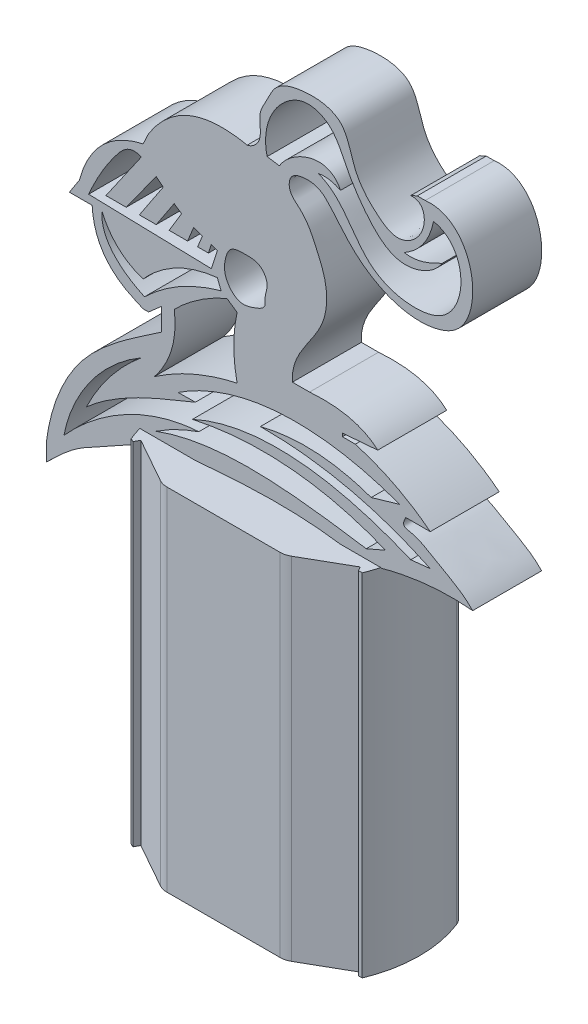
from build123d import *

# Parameters (mm, degrees)
BOSS_EXTRUDE3_DEPTH     = 19.558
SKETCH3_R               = 35.486653225
BOSS_EXTRUDE4_DEPTH     = 99.480957
CUT_EXTRUDE_THIN2_DEPTH = 99.480957295
CUT_EXTRUDE1_DEPTH      = 300.228
FILLET4_R               = 5.08
FILLET5_R               = 5.08


# Read off the part's stored shape, not the designer's step: Cut-Extrude-Thin2
with BuildPart() as part:
    # Sketch1 → Boss-Extrude3 (new body)
    with BuildSketch(Plane.XY):
        with BuildLine():
            Line((-60.677152208, 82.715970074), (-60.677152208, 77.913415786))
            add(Edge.make_bspline(
                [(30.016770012, 98.07305176), (20.185298771, 100.36910014), (4.789458608, 101.194375677), (-14.213048057, 99.85670085), (-30.375831286, 98.43035412), (-41.551512661, 91.295063212), (-53.246281565, 85.238550148), (-57.793663734, 80.827018036), (-60.677152208, 77.913415786)],
                knots=[0, 0, 0, 0, 0.31158423, 0.47315705, 0.592132294, 0.807667052, 0.872227534, 1, 1, 1, 1], degree=3))
            add(Edge.make_bspline(
                [(60.19386088, 101.918025448), (50.007948951, 102.888748335), (39.681222816, 101.300957278), (30.016770012, 98.07305176)],
                knots=[0, 0, 0, 0, 1, 1, 1, 1], degree=3))
            add(Edge.make_bspline(
                [(41.243752903, 115.30251661), (39.703798054, 112.694108611), (44.090999134, 112.551322074), (50.842104327, 108.046129823), (57.18579159, 105.1342568), (60.19386088, 101.918025448)],
                knots=[0, 0, 0, 0, 0.164002364, 0.469076584, 1, 1, 1, 1], degree=3))
            Line((41.243752903, 115.30251661), (48.162854267, 115.30251661))
            add(Edge.make_bspline(
                [(26.916452055, 126.149578653), (38.591326425, 122.80724244), (48.162854267, 115.30251661)],
                knots=[0, 0, 0, 1, 1, 1], degree=2))
            Line((26.916452055, 126.149578653), (23.264490711, 126.149578653))
            Line((23.264490711, 126.149578653), (23.264490711, 127.068170072))
            Line((23.264490711, 127.068170072), (33.266010615, 127.859027189))
            add(Edge.make_bspline(
                [(13.948795482, 132.459358072), (20.387960601, 132.953827447), (28.23597356, 132.483885253), (33.266010615, 127.859027189)],
                knots=[0, 0, 0, 0, 1, 1, 1, 1], degree=3))
            Line((13.948795482, 132.459358072), (9.084669321, 132.459358072))
            add(Edge.make_bspline(
                [(46.743103088, 195.892769416), (55.09877753, 196.830483223), (63.034523092, 184.081413301), (58.014195484, 168.906615772), (48.639347856, 165.20227689), (38.285922019, 165.417839766), (27.631291208, 171.430251937), (21.527391658, 179.068797264), (17.049346043, 184.081991744), (12.546993735, 184.47803916), (8.837597784, 183.601079766), (7.995126163, 180.790231984), (8.652083687, 177.981887781), (12.959265844, 175.104516447), (15.796280281, 168.949130641), (19.211061486, 161.08940092), (18.544871852, 147.306887261), (8.612518026, 140.387902408), (9.084669321, 132.459358072)],
                knots=[0, 0, 0, 0, 0.152227234, 0.248918484, 0.284419242, 0.35475769, 0.458069127, 0.523985856, 0.562095732, 0.58947856, 0.615651623, 0.631826664, 0.644591406, 0.67341574, 0.732604024, 0.782537753, 0.851498118, 1, 1, 1, 1], degree=3))
            Line((46.743103088, 195.892769416), (44.477575243, 195.892769416))
            Line((44.477575243, 195.892769416), (42.622392391, 195.046200346))
            add(Edge.make_bspline(
                [(-3.717960268, 184.246697923), (-2.353047454, 184.515270633), (1.198224868, 187.44806759), (-1.024857634, 193.042519357), (1.887451493, 197.991151897), (4.124989357, 203.568089151), (12.666211712, 206.139291239), (24.337005741, 205.11434396), (26.066522529, 192.889574121), (31.808775784, 186.352264827), (39.460398232, 181.063111301), (47.924370487, 187.398410657), (46.35249087, 195.413976093), (42.622392391, 195.046200346)],
                knots=[0, 0, 0, 0, 0.04918634, 0.13607101, 0.174661028, 0.249706237, 0.337266205, 0.473485316, 0.595575173, 0.71635223, 0.787048497, 0.896790448, 1, 1, 1, 1], degree=3))
            add(Edge.make_bspline(
                [(-31.674223124, 173.109443714), (-22.133669839, 188.091608552), (-3.717960268, 184.246697923)],
                knots=[0, 0, 0, 1, 1, 1], degree=2))
            Line((-31.674223124, 173.109443714), (-33.241322671, 169.770758782))
            add(Edge.make_bspline(
                [(-51.324809648, 151.838117699), (-47.241094312, 166.746808106), (-33.241322671, 169.770758782)],
                knots=[0, 0, 0, 1, 1, 1], degree=2))
            Line((-51.324809648, 151.838117699), (-54.130088106, 147.487999636))
            Line((-54.130088106, 147.487999636), (-47.682870722, 147.487999636))
            add(Edge.make_bspline(
                [(-35.480036309, 130.295268222), (-47.02552867, 135.290372026), (-47.682870722, 147.487999636)],
                knots=[0, 0, 0, 1, 1, 1], degree=2))
            Line((-35.480036309, 130.295268222), (-33.241322671, 129.304468363))
            Line((-33.241322671, 129.304468363), (-31.674223124, 129.304468363))
            Line((-31.674223124, 129.304468363), (-28.090720187, 132.459358072))
            Line((-28.090720187, 132.459358072), (-28.090720187, 126.149578653))
            add(Edge.make_bspline(
                [(-60.677152208, 82.715970074), (-59.642972889, 91.689788648), (-52.648396027, 110.376938865), (-35.923683872, 120.757880413), (-28.090720187, 126.149578653)],
                knots=[0, 0, 0, 0, 0.485125942, 1, 1, 1, 1], degree=3))
        make_face()
        with BuildLine():
            add(Edge.make_bspline(
                [(39.513116273, 117.671095951), (19.334428102, 125.126578304), (-4.226704119, 126.254055262), (-23.334036199, 113.729723738)],
                knots=[0, 0, 0, 0, 1, 1, 1, 1], degree=3))
            Line((39.513116273, 117.671095951), (31.41031902, 115.30251661))
            add(Edge.make_bspline(
                [(0, 117.023423535), (15.659192386, 120.970988255), (31.41031902, 115.30251661)],
                knots=[0, 0, 0, 1, 1, 1], degree=2))
            add(Edge.make_bspline(
                [(48.162854267, 106.214160788), (25.381931938, 117.14250467), (0, 117.023423535)],
                knots=[0, 0, 0, 1, 1, 1], degree=2))
            Line((48.162854267, 106.214160788), (42.622392391, 105.634455938))
            add(Edge.make_bspline(
                [(-19.243087735, 109.177410485), (0.469819313, 118.195627583), (23.363247912, 113.79633541), (42.622392391, 105.634455938)],
                knots=[0, 0, 0, 0, 1, 1, 1, 1], degree=3))
            add(Edge.make_bspline(
                [(35.492400909, 104.413439054), (9.11674172, 115.23351852), (-19.243087735, 109.177410485)],
                knots=[0, 0, 0, 1, 1, 1], degree=2))
            Line((35.492400909, 104.413439054), (30.016770012, 102.031453339))
            add(Edge.make_bspline(
                [(-29.528901016, 101.100906553), (-10.566563263, 108.058460379), (10.548485482, 104.973143967), (30.016770012, 102.031453339)],
                knots=[0, 0, 0, 0, 1, 1, 1, 1], degree=3))
            add(Edge.make_bspline(
                [(-17.456062437, 107.01901021), (-23.884225366, 104.838576938), (-29.528901016, 101.100906553)],
                knots=[0, 0, 0, 1, 1, 1], degree=2))
            add(Edge.make_bspline(
                [(-55.682734312, 87.010183561), (-46.0869699, 97.764595752), (-32.123368157, 106.163886836), (-17.456062437, 107.01901021)],
                knots=[0, 0, 0, 0, 1, 1, 1, 1], degree=3))
            add(Edge.make_bspline(
                [(-33.74817552, 117.023423535), (-44.717081812, 110.70674633), (-53.248046382, 99.498954954), (-55.682734312, 87.010183561)],
                knots=[0, 0, 0, 0, 1, 1, 1, 1], degree=3))
            add(Edge.make_bspline(
                [(-49.334636638, 97.154424427), (-43.720972742, 108.795755025), (-33.74817552, 117.023423535)],
                knots=[0, 0, 0, 1, 1, 1], degree=2))
            add(Edge.make_bspline(
                [(-18.418099097, 113.788391549), (-29.276330325, 109.356124962), (-40.453396293, 105.104539707), (-49.334636638, 97.154424427)],
                knots=[0, 0, 0, 0, 1, 1, 1, 1], degree=3))
            Line((-18.418099097, 113.788391549), (-23.334036199, 113.729723738))
        make_face(mode=Mode.SUBTRACT)
        with BuildLine():
            add(Edge.make_bspline(
                [(-12.180077925, 147.487999636), (-24.850486219, 146.074542076), (-33.241322671, 136.603219196)],
                knots=[0, 0, 0, 1, 1, 1], degree=2))
            Line((-12.180077925, 147.487999636), (-11.132742439, 144.755526725))
            add(Edge.make_bspline(
                [(-32.840255532, 132.459358072), (-23.584581896, 141.386289097), (-11.132742439, 144.755526725)],
                knots=[0, 0, 0, 1, 1, 1], degree=2))
            add(Edge.make_bspline(
                [(-44.919821501, 147.487999636), (-45.418257954, 140.191634597), (-38.845020152, 135.226465923), (-32.840255532, 132.459358072)],
                knots=[0, 0, 0, 0, 1, 1, 1, 1], degree=3))
            add(Edge.make_bspline(
                [(-33.241322671, 136.603219196), (-41.4662126, 139.392094446), (-44.919821501, 147.487999636)],
                knots=[0, 0, 0, 1, 1, 1], degree=2))
        make_face(mode=Mode.SUBTRACT)
        with BuildLine():
            Line((-9.464974671, 143.736148235), (-6.582293484, 141.76976548))
            add(Edge.make_bspline(
                [(-6.582293484, 124.380905207), (-8.490712642, 133.107294846), (-6.582293484, 141.76976548)],
                knots=[0, 0, 0, 1, 1, 1], degree=2))
            add(Edge.make_bspline(
                [(-30.059751144, 114.249314386), (-19.311828591, 121.632299031), (-6.582293484, 124.380905207)],
                knots=[0, 0, 0, 1, 1, 1], degree=2))
            add(Edge.make_bspline(
                [(-24.390505733, 133.613780095), (-23.033722159, 122.895763273), (-30.059751144, 114.249314386)],
                knots=[0, 0, 0, 1, 1, 1], degree=2))
            add(Edge.make_bspline(
                [(-9.464974671, 143.736148235), (-17.865777935, 140.166326629), (-24.390505733, 133.613780095)],
                knots=[0, 0, 0, 1, 1, 1], degree=2))
        make_face(mode=Mode.SUBTRACT)
        with BuildLine():
            add(Edge.make_bspline(
                [(-33.748175518, 166.311014289), (-37.077212001, 167.741096088), (-42.881844643, 161.2772177), (-46.502523407, 154.617326437), (-48.683816498, 149.715130736)],
                knots=[0.017154771, 0.017154771, 0.017154771, 0.017154771, 0.361798915, 1, 1, 1, 1], degree=3))
            Line((-33.748175518, 166.311014289), (-43.777717141, 151.838117702))
            Line((-43.777717141, 151.838117702), (-38.020338264, 151.838117702))
            Line((-38.020338264, 151.838117702), (-29.528901015, 163.652458933))
            add(Edge.make_bspline(
                [(-29.528901015, 163.652458933), (-28.851821821, 163.128600994), (-28.189395165, 162.582286157), (-27.529322994, 162.03315705)],
                knots=[0.713527699, 0.713527699, 0.713527699, 0.713527699, 0.818409951, 0.818409951, 0.818409951, 0.818409951], degree=3))
            Line((-27.529322994, 162.03315705), (-34.295540663, 151.838117699))
            Line((-34.295540663, 151.838117699), (-29.528901016, 151.838117699))
            Line((-29.528901016, 151.838117699), (-24.425218076, 159.528122804))
            add(Edge.make_bspline(
                [(-24.425218076, 159.528122804), (-23.745851307, 159.019902877), (-23.04989065, 158.539124848), (-22.325202193, 158.105169175)],
                knots=[0.981281921, 0.981281921, 0.981281921, 0.981281921, 1.085695459, 1.085695459, 1.085695459, 1.085695459], degree=3))
            Line((-22.325202193, 158.105169175), (-25.865859126, 152.253779486))
            Line((-25.865859126, 152.253779486), (-20.618536184, 152.253779486))
            Line((-20.618536184, 152.253779486), (-18.919957562, 156.435648463))
            add(Edge.make_bspline(
                [(-18.919957562, 156.435648463), (-18.109049623, 156.106276382), (-17.282379919, 155.807463523), (-16.449936402, 155.526281393)],
                knots=[1.24149573, 1.24149573, 1.24149573, 1.24149573, 1.348690449, 1.348690449, 1.348690449, 1.348690449], degree=3))
            Line((-16.449936402, 155.526281393), (-17.779152526, 152.253776016))
            Line((-17.779152526, 152.253776016), (-14.704789456, 152.253776016))
            Line((-14.704789456, 152.253776016), (-13.939149736, 154.720798471))
            add(Edge.make_bspline(
                [(-13.939149736, 154.720798471), (-13.349496896, 154.537799879), (-12.761962905, 154.357136096), (-12.180077925, 154.174237645)],
                knots=[1.456147486, 1.456147486, 1.456147486, 1.456147486, 1.53193765, 1.53193765, 1.53193765, 1.53193765], degree=3))
            Line((-12.180077925, 154.174237645), (-13.866412611, 148.833602803))
            Line((-13.866412611, 148.833602803), (-48.683816498, 149.715130736))
        make_face(mode=Mode.SUBTRACT)
        with BuildLine():
            add(Edge.make_bspline(
                [(1.313393343, 148.833602803), (1.300828635, 150.253406355), (2.663550406, 152.763263302), (0.115117384, 157.134644984), (-4.239780701, 157.21574672), (-8.683365258, 157.037539764), (-10.182252694, 152.891745152), (-10.383485615, 148.401719757), (-6.332191435, 143.867488985), (-1.919911973, 145.161043625), (1.608647985, 146.64063325), (1.317495032, 148.370114634), (1.313393343, 148.833602803)],
                knots=[0, 0, 0, 0, 0.104941694, 0.203603886, 0.320484007, 0.422618948, 0.505549141, 0.620931954, 0.766138667, 0.875772916, 0.965742279, 1, 1, 1, 1], degree=3))
        make_face(mode=Mode.SUBTRACT)
        with BuildLine():
            add(Edge.make_bspline(
                [(49.076470011, 191.92137483), (47.601240009, 184.112999173), (40.811033381, 180.14787999)],
                knots=[0, 0, 0, 1, 1, 1], degree=2))
            add(Edge.make_bspline(
                [(49.076470011, 191.92137483), (54.229986617, 190.950020476), (58.997531412, 182.08313952), (53.816584799, 169.497031946), (42.072135917, 167.19172702), (27.329804851, 172.042022342), (23.573090073, 184.879491309), (16.350273598, 187.365934933)],
                knots=[0, 0, 0, 0, 0.206454368, 0.375347428, 0.503210106, 0.688686532, 1, 1, 1, 1], degree=3))
            add(Edge.make_bspline(
                [(16.350273598, 187.365934933), (19.679639059, 187.959159053), (22.717550426, 186.359500537)],
                knots=[0, 0, 0, 1, 1, 1], degree=2))
            add(Edge.make_bspline(
                [(22.717550426, 186.359500537), (19.155271663, 193.997035853), (8.420959814, 189.046420888), (5.403871556, 183.741035358)],
                knots=[0, 0, 0, 0, 1, 1, 1, 1], degree=3))
            Line((5.403871556, 183.741035358), (1.913452846, 184.246697923))
            add(Edge.make_bspline(
                [(1.913452846, 184.246697923), (0.564118043, 189.777633395), (3.145169972, 198.490589487), (12.688890989, 203.981731479), (20.777569915, 201.136505668), (24.228538082, 192.678658422), (29.643386147, 184.253558614), (38.931078735, 174.583032573), (49.090720693, 178.912170514), (51.541015463, 182.8537672)],
                knots=[0, 0, 0, 0, 0.222621806, 0.317277818, 0.401605713, 0.525868461, 0.65802131, 0.812427119, 1, 1, 1, 1], degree=3))
            add(Edge.make_bspline(
                [(51.541015463, 182.8537672), (48.225197985, 181.227469802), (44.639009022, 179.414357984), (40.811033381, 180.14787999)],
                knots=[0, 0, 0, 0, 1, 1, 1, 1], degree=3))
        make_face(mode=Mode.SUBTRACT)
    extrude(amount=BOSS_EXTRUDE3_DEPTH)

    # Sketch3 → Boss-Extrude4 (add)
    with BuildSketch(Plane(origin=(0, 0, 0), x_dir=(1, 0, 0), z_dir=(0, 1, 0))):
        with Locations(Location((0, -9.941122135, 0), (0, 0, 163.731622638))):
            Circle(SKETCH3_R)
    extrude(amount=BOSS_EXTRUDE4_DEPTH)

    # Cut-Extrude-Thin2 outline → Cut-Extrude-Thin2 (cut)
    with BuildSketch(Plane(origin=(0, 0, 0), x_dir=(1, 0, 0), z_dir=(0, 1, 0))):
        Polygon((17.526209308, -30.098221094), (-17.286634264, -30.098221094), (-31.096236402, -22.333848906), (-32.341070125, -24.547892493), (-17.951726538, -32.638221094), (18.20150966, -32.638221094), (32.341070125, -24.547892493), (31.079633887, -22.343265853), align=None)
        with BuildLine():
            ThreePointArc((-30.07655468, 8.892449372), (-31.280288259, 6.817342101), (-32.341070125, 4.665648222))
            Line((-32.341070125, 4.665648222), (-17.951726538, 12.918098959))
            Line((-17.951726538, 12.918098959), (18.20150966, 12.918098959))
            Line((18.20150966, 12.918098959), (32.341070125, 4.665648222))
            ThreePointArc((32.341070125, 4.665648222), (31.26451466, 6.846750875), (30.041079074, 8.948984407))
            Line((30.041079074, 8.948984407), (18.888510981, 15.458098959))
            Line((18.888510981, 15.458098959), (-18.628393304, 15.458098959))
            Line((-18.628393304, 15.458098959), (-30.07655468, 8.892449372))
        make_face()
    extrude(amount=CUT_EXTRUDE_THIN2_DEPTH, mode=Mode.SUBTRACT)

    # Sketch6 → Cut-Extrude1 (cut)
    with BuildSketch(Plane(origin=(0, 0, 0), x_dir=(1, 0, 0), z_dir=(0, 1, 0))):
        Polygon((-30.110886694, 7.730190625), (-17.465360131, 14.052953906), (19.012120338, 14.052953906), (33.44099039, 4.811992188), (33.44099039, 26.536358334), (12.20299065, 31.400022396), (-4.819833569, 28.968190365), (-8.062276277, 28.968190365), (-22.653268465, 26.536358334), (-33.515451538, 15.674175261), align=None)
        Polygon((-27.192688257, -26.153335677), (-37.892749194, -20.803305208), (-37.892749194, -37.988251563), (-37.892749194, -39.447350782), (41.384975025, -55.821686459), (45.438028411, -29.395778386), (43.411501718, -23.478320443), (36.521310963, -23.478320443), (30.684914088, -23.478320443), (19.012120338, -31.341244011), (-18.113848673, -31.341244011), align=None)
    extrude(amount=CUT_EXTRUDE1_DEPTH, mode=Mode.SUBTRACT)

    # Fillet4
    fillet4_edges = [part.edges().sort_by_distance(p)[0] for p in [
        (-17.286634264, 49.740478647, 30.098221094),
        (17.526209308, 49.740478647, 30.098221094),
        (32.341070125, 49.740478647, -4.665648222),
    ]]
    fillet(fillet4_edges, radius=FILLET4_R)

    # Fillet5
    fillet5_edges = [part.edges().sort_by_distance(p)[0] for p in [
        (-17.951726538, 49.740478647, -12.918098959),
        (18.20150966, 49.740478647, -12.918098959),
    ]]
    fillet(fillet5_edges, radius=FILLET5_R)


solid = part.part
